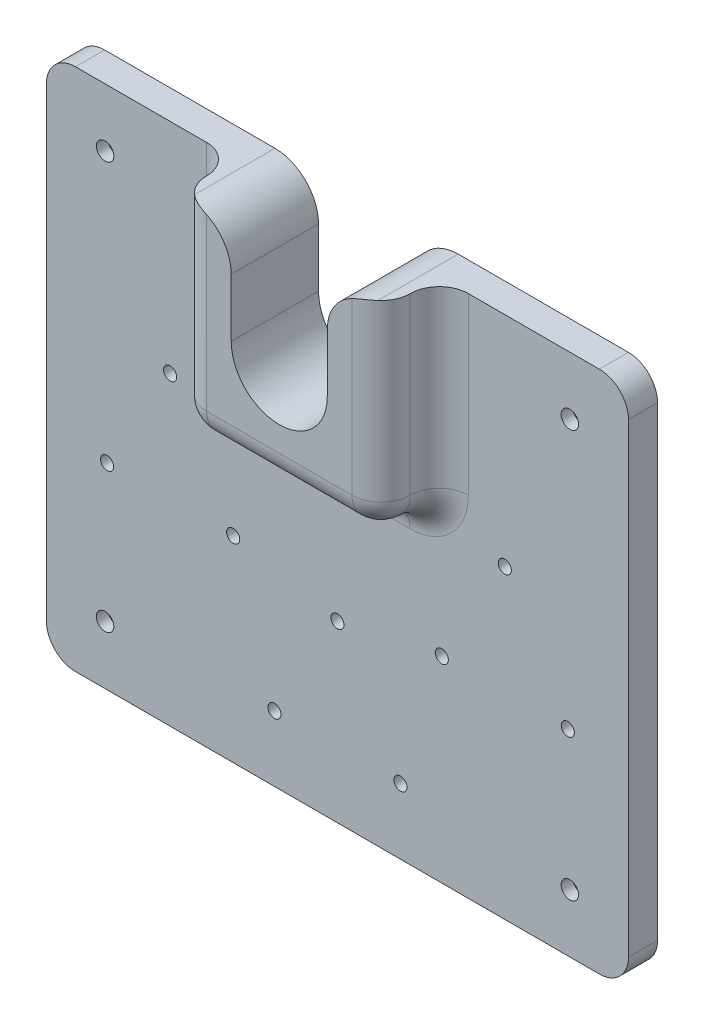
from build123d import *

# Parameters (mm, degrees)
SKETCH1_W               = 200
SKETCH1_H               = 180
BOSS_EXTRUDE1_DEPTH     = 10
FILLET1_R               = 10
CUT_EXTRUDE5_DEPTH      = 135.907375632
CUT_EXTRUDE5_DEPTH_BACK = 135.907375632
SKETCH26_R              = 1.75
SKETCH27_R              = 3
CUT_EXTRUDE6_DEPTH      = 4
SKETCH28_W              = 70
SKETCH28_H              = 70
BOSS_EXTRUDE2_DEPTH     = 20
CUT_EXTRUDE8_DEPTH      = 138.840487521
CUT_EXTRUDE8_DEPTH_BACK = 138.840487521
FILLET3_R               = 10
FILLET4_R               = 15
CUT_EXTRUDE9_DEPTH      = 137.014705168
CUT_EXTRUDE9_DEPTH_BACK = 137.014705168
SKETCH30_R              = 2.25


with BuildPart() as part:
    # Sketch1 → Boss-Extrude1 (new body)
    with BuildSketch(Plane.XY):
        Rectangle(SKETCH1_W, SKETCH1_H)
    extrude(amount=BOSS_EXTRUDE1_DEPTH)

    # Fillet1
    fillet1_edges = [part.edges().sort_by_distance(p)[0] for p in [
        (100, -90, 5),
        (-100, -90, 5),
        (-100, 90, 5),
        (100, 90, 5),
    ]]
    fillet(fillet1_edges, radius=FILLET1_R)

    # Sketch26 → Cut-Extrude5 (cut, two sides: drawn at the far end of the back side and taken through both)
    with BuildSketch(Plane(origin=(0, 0, 0), x_dir=(-1, 0, 0), z_dir=(0, 0, -1)).offset(-CUT_EXTRUDE5_DEPTH_BACK)):
        with Locations((-79.85, 70)):
            Circle(SKETCH26_R)
        with Locations((-79.85, -70)):
            Circle(SKETCH26_R)
        with Locations((79.85, -70)):
            Circle(SKETCH26_R)
        with Locations((79.85, 70)):
            Circle(SKETCH26_R)
    extrude(amount=CUT_EXTRUDE5_DEPTH + CUT_EXTRUDE5_DEPTH_BACK, mode=Mode.SUBTRACT)

    # Sketch27 → Cut-Extrude6 (cut)
    with BuildSketch(Plane.XY.offset(10)):
        with Locations((-79.85, 70)):
            Circle(SKETCH27_R)
        with Locations((79.85, 70)):
            Circle(SKETCH27_R)
        with Locations((79.85, -70)):
            Circle(SKETCH27_R)
        with Locations((-79.85, -70)):
            Circle(SKETCH27_R)
    extrude(amount=-CUT_EXTRUDE6_DEPTH, mode=Mode.SUBTRACT)

    # Sketch28 → Boss-Extrude2 (add)
    with BuildSketch(Plane.XY.offset(10)):
        with Locations((0, 55)):
            Rectangle(SKETCH28_W, SKETCH28_H)
    extrude(amount=BOSS_EXTRUDE2_DEPTH)

    # Sketch29 → Cut-Extrude8 (cut, two sides: drawn at the far end of the back side and taken through both)
    with BuildSketch(Plane.XY.offset(30).offset(-CUT_EXTRUDE8_DEPTH_BACK)):
        with BuildLine():
            Line((-16.5, 55), (-16.5, 90))
            Line((-16.5, 90), (16.5, 90))
            Line((16.5, 90), (16.5, 55))
            ThreePointArc((16.5, 55), (0, 38.5), (-16.5, 55))
        make_face()
    extrude(amount=CUT_EXTRUDE8_DEPTH + CUT_EXTRUDE8_DEPTH_BACK, mode=Mode.SUBTRACT)

    # Fillet3
    fillet3_edges = [part.edges().sort_by_distance(p)[0] for p in [
        (0, 20, 30),
        (-35, 20, 20),
        (0, 20, 10),
        (-35, 55, 30),
        (-35, 55, 10),
        (35, 55, 30),
        (35, 20, 20),
        (35, 55, 10),
    ]]
    fillet(fillet3_edges, radius=FILLET3_R - 0.0001)  # a hair under: the kernel refuses the full size

    # Fillet4
    fillet4_edges = [part.edges().sort_by_distance(p)[0] for p in [
        (16.5, 90, 15),
        (-16.5, 90, 15),
    ]]
    fillet(fillet4_edges, radius=FILLET4_R)

    # Sketch30 → Cut-Extrude9 (cut, two sides: drawn at the far end of the back side and taken through both)
    with BuildSketch(Plane.XY.offset(10).offset(-CUT_EXTRUDE9_DEPTH_BACK)):
        with Locations((-21.650635095, -67.5)):
            Circle(SKETCH30_R)
        with Locations((21.650635095, -67.5)):
            Circle(SKETCH30_R)
        with Locations((0, -30)):
            Circle(SKETCH30_R)
        with Locations((-79.150635095, -22.5)):
            Circle(SKETCH30_R)
        with Locations((-35.849364905, -22.5)):
            Circle(SKETCH30_R)
        with Locations((-57.5, 15)):
            Circle(SKETCH30_R)
        with Locations((35.849364905, -22.5)):
            Circle(SKETCH30_R)
        with Locations((79.150635095, -22.5)):
            Circle(SKETCH30_R)
        with Locations((57.5, 15)):
            Circle(SKETCH30_R)
    extrude(amount=CUT_EXTRUDE9_DEPTH + CUT_EXTRUDE9_DEPTH_BACK, mode=Mode.SUBTRACT)


solid = part.part
